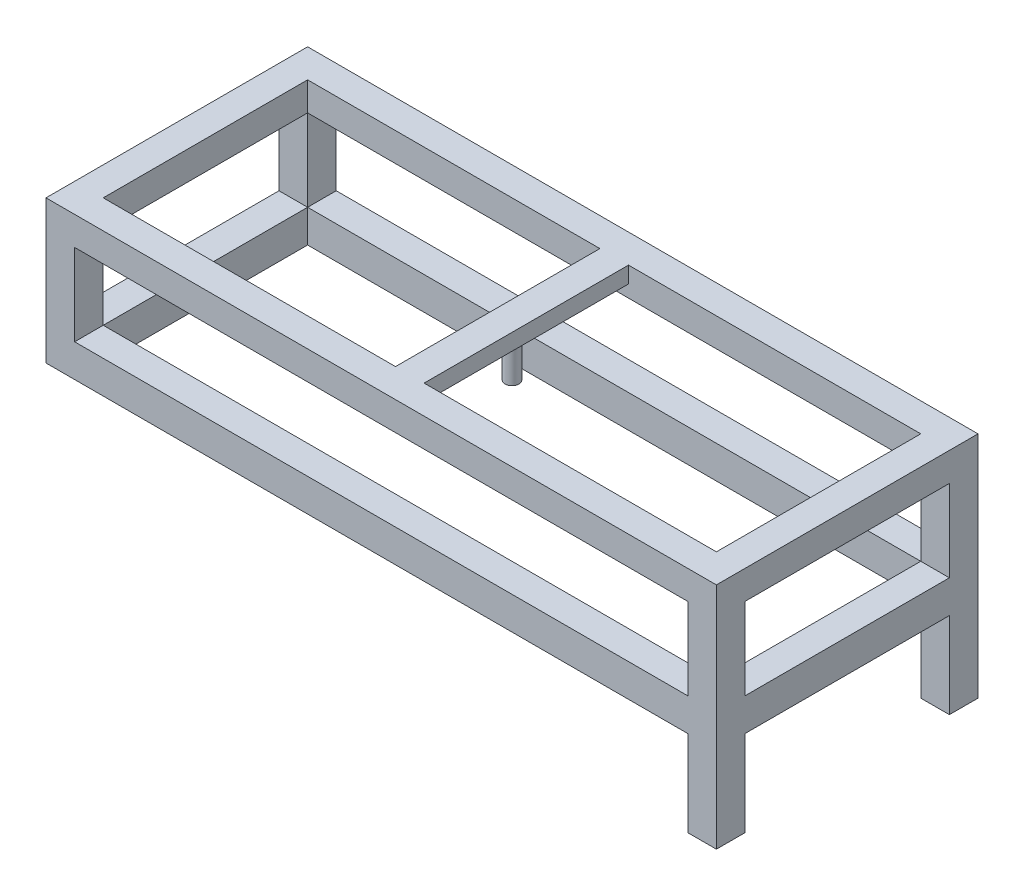
from build123d import *

# Parameters (mm, degrees)
SKETCH2_W            = 820
SKETCH2_H            = 320
SKETCH2_W_2          = 750
SKETCH2_H_2          = 250
BOSS_EXTRUDE1_DEPTH  = 35
SKETCH7_W            = 35
SKETCH7_H            = 250
BOSS_EXTRUDE6_DEPTH  = 20
SKETCH3_W            = 35
SKETCH3_H            = 35
BOSS_EXTRUDE2_DEPTH  = 100
SKETCH4_W            = 820
SKETCH4_H            = 320
SKETCH4_W_2          = 750
SKETCH4_H_2          = 250
BOSS_EXTRUDE3_DEPTH  = 40
SKETCH5_W            = 35
SKETCH5_H            = 35
BOSS_EXTRUDE4_DEPTH  = 105
SHELL1_START         = -173.5
SHELL1_OUTLINE_W     = 817
SHELL1_OUTLINE_H     = 317
SHELL1_OUTLINE_W_2   = 753
SHELL1_OUTLINE_H_2   = 253
SHELL1_DEPTH         = 37
SHELL1_START_2       = -33.5
SHELL1_2_OUTLINE_W   = 817
SHELL1_2_OUTLINE_H   = 317
SHELL1_2_OUTLINE_W_2 = 753
SHELL1_2_OUTLINE_H_2 = 253
SHELL1_2_DEPTH       = 32
SHELL1_START_3       = -280
SHELL1_3_OUTLINE_W   = 32
SHELL1_3_OUTLINE_H   = 32
SHELL1_3_DEPTH       = 246.5
SHELL1_START_4       = -136.5
SHELL1_4_OUTLINE_W   = 32
SHELL1_4_OUTLINE_H   = 32
SHELL1_4_DEPTH       = 103
SHELL1_START_5       = -18.5
SHELL1_5_OUTLINE_W   = 32
SHELL1_5_OUTLINE_H   = 253
SHELL1_5_DEPTH       = 17
BOSS_EXTRUDE5_START  = 20
SKETCH6_R            = 8.5
BOSS_EXTRUDE5_DEPTH  = 48
SKETCH8_R            = 4
CUT_EXTRUDE1_DEPTH   = 30


# Read off the part's stored shape, not the designer's step: Shell1
with BuildPart() as part:
    # Sketch2 → Boss-Extrude1 (new body)
    with BuildSketch(Plane(origin=(0, 0, 0), x_dir=(1, 0, 0), z_dir=(0, 1, 0))):
        with Locations((410, 160)):
            Rectangle(SKETCH2_W, SKETCH2_H)
        with Locations((410, 160)):
            Rectangle(SKETCH2_W_2, SKETCH2_H_2, mode=Mode.SUBTRACT)
    extrude(amount=-BOSS_EXTRUDE1_DEPTH)

    # Sketch7 → Boss-Extrude6 (add)
    with BuildSketch(Plane(origin=(0, 0, 0), x_dir=(1, 0, 0), z_dir=(0, 1, 0))):
        with Locations((410, 160)):
            Rectangle(SKETCH7_W, SKETCH7_H)
    extrude(amount=-BOSS_EXTRUDE6_DEPTH)

    # Sketch3 → Boss-Extrude2 (add)
    with BuildSketch(Plane(origin=(0, -35, 0), x_dir=(-1, 0, 0), z_dir=(0, -1, 0))):
        with Locations((-17.5, 17.5)):
            Rectangle(SKETCH3_W, SKETCH3_H)
        with Locations((-17.5, 302.5)):
            Rectangle(SKETCH3_W, SKETCH3_H)
        with Locations((-802.5, 302.5)):
            Rectangle(SKETCH3_W, SKETCH3_H)
        with Locations((-802.5, 17.5)):
            Rectangle(SKETCH3_W, SKETCH3_H)
    extrude(amount=BOSS_EXTRUDE2_DEPTH)

    # Sketch4 → Boss-Extrude3 (add)
    with BuildSketch(Plane.XZ.offset(135)):
        with Locations((410, -160)):
            Rectangle(SKETCH4_W, SKETCH4_H)
        with Locations((410, -160)):
            Rectangle(SKETCH4_W_2, SKETCH4_H_2, mode=Mode.SUBTRACT)
    extrude(amount=BOSS_EXTRUDE3_DEPTH)

    # Sketch5 → Boss-Extrude4 (add)
    with BuildSketch(Plane.XZ.offset(175)):
        with Locations((802.5, -17.5)):
            Rectangle(SKETCH5_W, SKETCH5_H)
        with Locations((802.5, -302.5)):
            Rectangle(SKETCH5_W, SKETCH5_H)
    extrude(amount=BOSS_EXTRUDE4_DEPTH)

    # Shell1 outline → Shell1 (cut)
    with BuildSketch(Plane(origin=(0, 0, 0), x_dir=(1, 0, 0), z_dir=(0, 1, 0)).offset(SHELL1_START)):
        with Locations((410, 160)):
            Rectangle(SHELL1_OUTLINE_W, SHELL1_OUTLINE_H)
        with Locations((410, 160)):
            Rectangle(SHELL1_OUTLINE_W_2, SHELL1_OUTLINE_H_2, mode=Mode.SUBTRACT)
    extrude(amount=SHELL1_DEPTH, mode=Mode.SUBTRACT)

    # Shell1 2 outline → Shell1 2 (cut)
    with BuildSketch(Plane(origin=(0, 0, 0), x_dir=(1, 0, 0), z_dir=(0, 1, 0)).offset(SHELL1_START_2)):
        with Locations((410, 160)):
            Rectangle(SHELL1_2_OUTLINE_W, SHELL1_2_OUTLINE_H)
        with Locations((410, 160)):
            Rectangle(SHELL1_2_OUTLINE_W_2, SHELL1_2_OUTLINE_H_2, mode=Mode.SUBTRACT)
    extrude(amount=SHELL1_2_DEPTH, mode=Mode.SUBTRACT)

    # Shell1 3 outline → Shell1 3 (cut)
    with BuildSketch(Plane(origin=(0, 0, 0), x_dir=(1, 0, 0), z_dir=(0, 1, 0)).offset(SHELL1_START_3)):
        with Locations((802.5, 302.5)):
            Rectangle(SHELL1_3_OUTLINE_W, SHELL1_3_OUTLINE_H)
        with Locations((802.5, 17.5)):
            Rectangle(SHELL1_3_OUTLINE_W, SHELL1_3_OUTLINE_H)
    extrude(amount=SHELL1_3_DEPTH, mode=Mode.SUBTRACT)

    # Shell1 4 outline → Shell1 4 (cut)
    with BuildSketch(Plane(origin=(0, 0, 0), x_dir=(1, 0, 0), z_dir=(0, 1, 0)).offset(SHELL1_START_4)):
        with Locations((17.5, 302.5)):
            Rectangle(SHELL1_4_OUTLINE_W, SHELL1_4_OUTLINE_H)
        with Locations((17.5, 17.5)):
            Rectangle(SHELL1_4_OUTLINE_W, SHELL1_4_OUTLINE_H)
    extrude(amount=SHELL1_4_DEPTH, mode=Mode.SUBTRACT)

    # Shell1 5 outline → Shell1 5 (cut)
    with BuildSketch(Plane(origin=(0, 0, 0), x_dir=(1, 0, 0), z_dir=(0, 1, 0)).offset(SHELL1_START_5)):
        with Locations((410, 160)):
            Rectangle(SHELL1_5_OUTLINE_W, SHELL1_5_OUTLINE_H)
    extrude(amount=SHELL1_5_DEPTH, mode=Mode.SUBTRACT)

    # Sketch6 → Boss-Extrude5 (add)
    with BuildSketch(Plane(origin=(0, 0, 0), x_dir=(-1, 0, 0), z_dir=(0, -1, 0)).offset(BOSS_EXTRUDE5_START)):
        with Locations(Location((-410, 160, 0), (0, 0, 270))):
            Circle(SKETCH6_R)
    extrude(amount=BOSS_EXTRUDE5_DEPTH)

    # Sketch8 → Cut-Extrude1 (cut)
    with BuildSketch(Plane.XZ.offset(68)):
        with Locations(Location((410, -160, 0), (0, 0, 270))):
            Circle(SKETCH8_R)
    extrude(amount=-CUT_EXTRUDE1_DEPTH, mode=Mode.SUBTRACT)


solid = part.part
